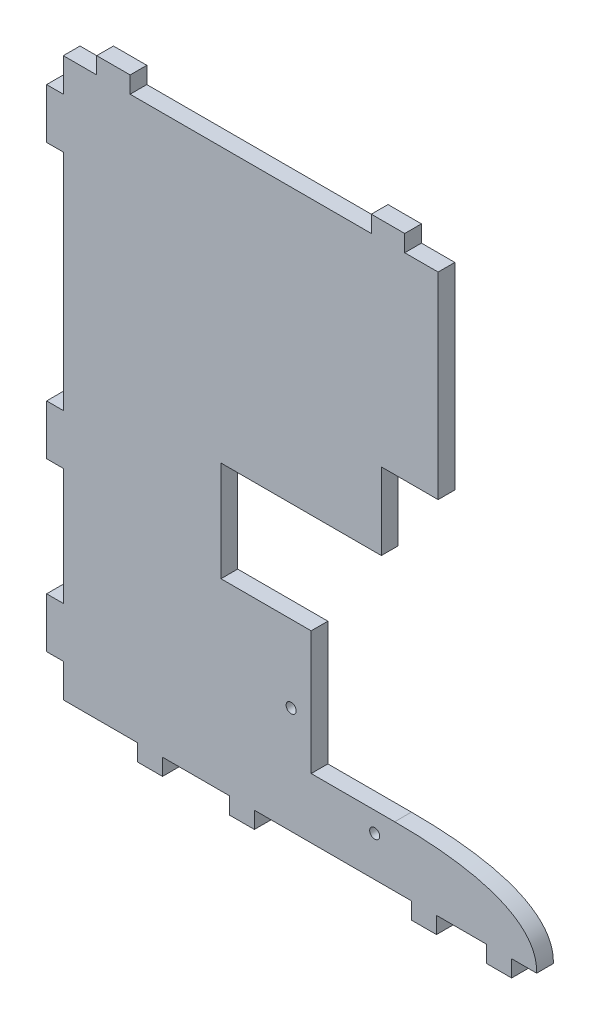
from build123d import *

# Parameters (mm, degrees)
ESQUISSE1_R        = 1.5
BOSS_EXTRU_1_DEPTH = 5
BOSS_EXTRU_2_DEPTH = 5


with BuildPart() as part:
    # Esquisse1 → Boss.-Extru.1 (new body)
    with BuildSketch(Plane.XY):
        Polygon((0, 0), (37, 0), (37, 18), (12, 18), (12, 55), (0, 55), align=None)
        with Locations((6, 32)):
            Circle(ESQUISSE1_R, mode=Mode.SUBTRACT)
        with Locations((31, 12)):
            Circle(ESQUISSE1_R, mode=Mode.SUBTRACT)
    extrude(amount=BOSS_EXTRU_1_DEPTH)

    # Esquisse2 → Boss.-Extru.2 (add)
    with BuildSketch(Plane.XY.offset(5)):
        with BuildLine():
            Line((37, 0), (42, 0))
            Line((42, 0), (42, -5))
            Line((42, -5), (49.5, -5))
            Line((49.5, -5), (49.5, 0))
            Line((49.5, 0), (64.5, 0))
            Line((64.5, 0), (64.5, -5))
            Line((64.5, -5), (72, -5))
            Line((72, -5), (72, 0))
            Line((72, 0), (79.5, 0))
            add(Edge.make_bspline(
                [(37, 18), (79.239532327, 18), (79.5, 3.874285435), (79.5, 0)],
                knots=[0, 0, 0, 0, 1, 1, 1, 1], degree=3))
            Line((37, 18), (37, 0))
        make_face()
        Polygon((0, 0), (-5, 0), (-5, -5), (-12.5, -5), (-12.5, 0), (-32.5, 0), (-32.5, -5), (-40, -5), (-40, 0), (-62.19, 0), (-62.19, 10), (-67.19, 10), (-67.19, 25), (-62.19, 25), (-62.19, 60), (-67.19, 60), (-67.19, 75), (-62.19, 75), (-62.19, 142), (-67.19, 142), (-67.19, 157), (-62.19, 157), (-62.19, 167), (-52.19, 167), (-52.19, 172), (-42.19, 172), (-42.19, 167), (30, 167), (30, 172), (40, 172), (40, 167), (50, 167), (50, 108), (33, 108), (33, 85), (-15, 85), (-15, 55), (0, 55), align=None)
    extrude(amount=-BOSS_EXTRU_2_DEPTH)


solid = part.part
